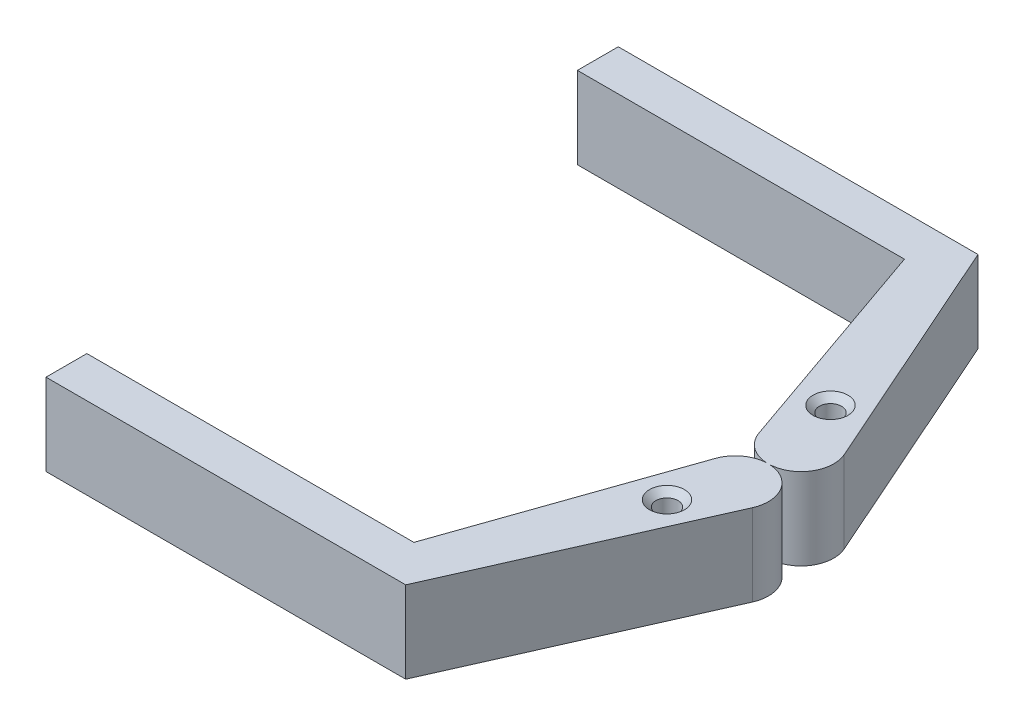
from build123d import *

# Parameters (mm, degrees)
BOSS_EXTRUDE1_DEPTH             = 12.7
F_8_32_TAPPED_HOLE1_D           = 3.4544
F_8_32_TAPPED_HOLE1_CSINK_D     = 5.4356
F_8_32_TAPPED_HOLE1_CSINK_ANGLE = 90


with BuildPart() as part:
    # Sketch2 → Boss-Extrude1 (new body)
    with BuildSketch(Plane(origin=(0, 0, 0), x_dir=(1, 0, 0), z_dir=(0, 1, 0))):
        with BuildLine():
            Line((-12.7, 38.1), (-0.608867514, 3.407965602))
            ThreePointArc((-0.608867514, 3.407965602), (1.249640005, 0.935980732), (4.197255653, -0.000139662))
            ThreePointArc((4.197255653, -0.000139662), (1.261426475, -0.940850451), (-0.589829567, -3.405983473))
            Line((-0.589829567, -3.405983473), (-12.7, -38.1))
            Line((-12.7, -38.1), (-63.5, -38.1))
            Line((-63.5, -38.1), (-63.5, -44.45))
            Line((-63.5, -44.45), (-12.7, -44.45))
            Line((-12.7, -44.45), (-7.62, -44.45))
            Line((-7.62, -44.45), (8.927890793, -7.139587376))
            ThreePointArc((8.927890793, -7.139587376), (8.540116646, -2.306362078), (4.275010607, 0))
            ThreePointArc((4.275010607, 0), (8.526277113, 2.31314021), (8.910483161, 7.137688919))
            Line((8.910483161, 7.137688919), (-7.62, 44.45))
            Line((-7.62, 44.45), (-12.7, 44.45))
            Line((-12.7, 44.45), (-63.5, 44.45))
            Line((-63.5, 44.45), (-63.5, 38.1))
            Line((-63.5, 38.1), (-12.7, 38.1))
        make_face()
    extrude(amount=BOSS_EXTRUDE1_DEPTH)

    # #8-32 Tapped Hole1 (through all)
    with Locations(Plane(origin=(0, 12.7, 0), x_dir=(1, 0, 0), z_dir=(0, 1, 0))):
        with Locations((1.215494837, 12.699860338), (1.215494837, -12.7)):
            CounterSinkHole(F_8_32_TAPPED_HOLE1_D / 2, F_8_32_TAPPED_HOLE1_CSINK_D / 2, counter_sink_angle=F_8_32_TAPPED_HOLE1_CSINK_ANGLE)


solid = part.part
